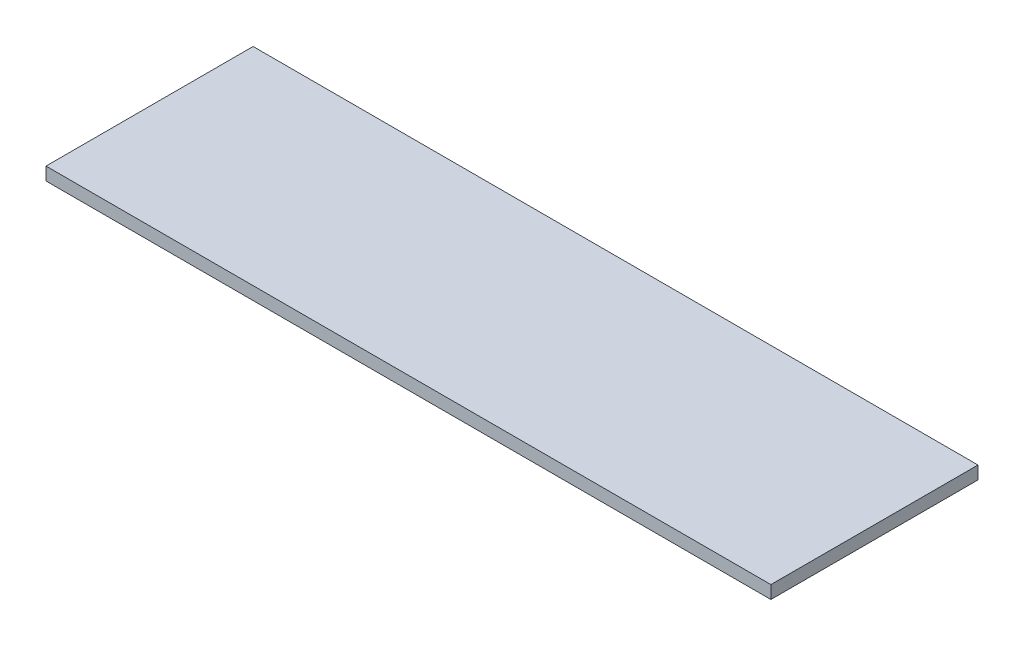
from build123d import *

# Parameters (mm, degrees)
SKETCH1_W           = 56
SKETCH1_H           = 16
BOSS_EXTRUDE1_DEPTH = 1


with BuildPart() as part:
    # Sketch1 → Boss-Extrude1 (new body)
    with BuildSketch(Plane(origin=(0, 0, 0), x_dir=(1, 0, 0), z_dir=(0, 1, 0))):
        Rectangle(SKETCH1_W, SKETCH1_H)
    extrude(amount=BOSS_EXTRUDE1_DEPTH)


solid = part.part
